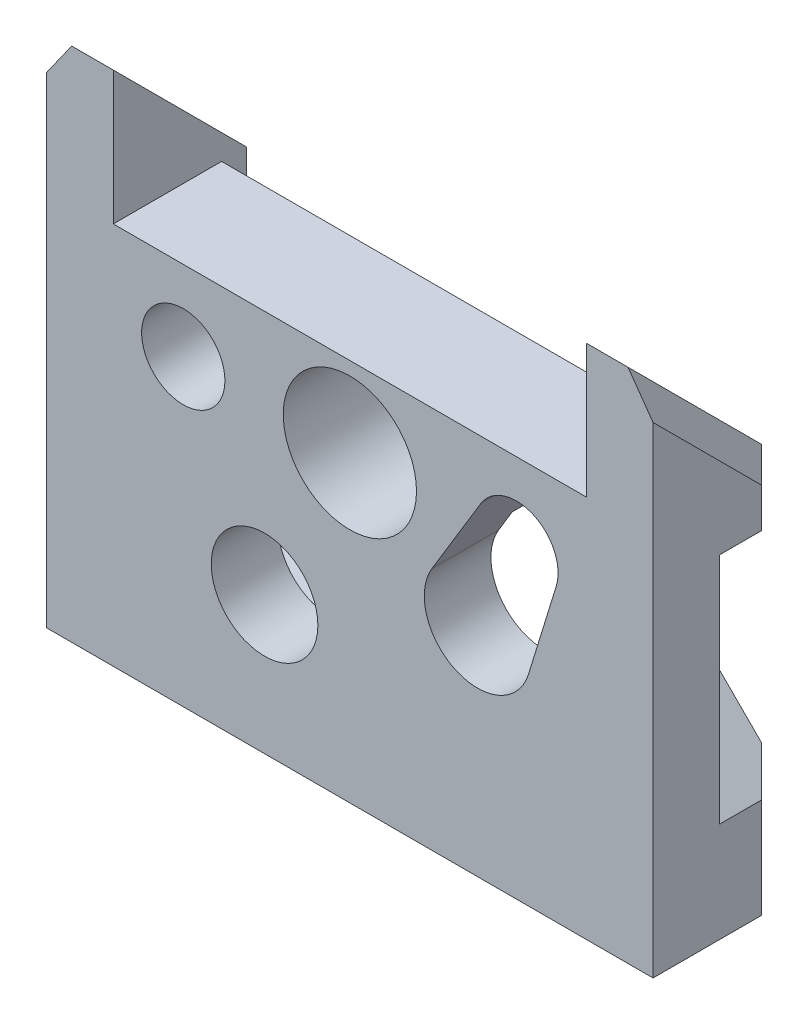
from build123d import *

# Parameters (mm, degrees)
OUTER_FRAME_EXTRUDE_DEPTH      = 4
OUTER_FRAME_EXTRUDE_DEPTH_BACK = 2
OUTSIDE_FRAME_W                = 18.2
OUTSIDE_FRAME_H                = 18.2
OUTSIDE_FRAME_W_2              = 14.2
OUTSIDE_FRAME_H_2              = 14.2
HOTSWAP_BASE_W                 = 18.2
HOTSWAP_BASE_H                 = 11.5
HOTSWAP_BASE_BLOCK_DEPTH       = 4
CUT_EXTRUDE4_DEPTH             = 16.15321748
CUT_EXTRUDE4_DEPTH_BACK        = 16.15321748
SKETCH1_W                      = 2
SKETCH1_H                      = 6.7
CUT_EXTRUDE1_DEPTH             = 4
SWITCH_PIN_HOLES_R             = 2
SWITCH_PIN_HOLES_R_2           = 1.25
SWITCH_HOLES_DEPTH             = 3.6
CUT_EXTRUDE3_REACH             = 17.153
HOTSWAP_HOLES_R                = 1.6
CHAMFER1_SIZE                  = 2
CHAMFER2_SIZE                  = 4
FILLET1_R                      = 0.35
CHAMFER3_SIZE                  = 0.75


# Some blends are built 0.0001 mm under size
with BuildPart() as part:
    # Outside Frame → Outer Frame Extrude (new, two sides: drawn at the far end of the back side and taken through both)
    with BuildSketch(Plane.XY.offset(-4).offset(-OUTER_FRAME_EXTRUDE_DEPTH_BACK)):
        Rectangle(OUTSIDE_FRAME_W, OUTSIDE_FRAME_H)
        Rectangle(OUTSIDE_FRAME_W_2, OUTSIDE_FRAME_H_2, mode=Mode.SUBTRACT)
    extrude(amount=OUTER_FRAME_EXTRUDE_DEPTH + OUTER_FRAME_EXTRUDE_DEPTH_BACK)

    # Hotswap Base → Hotswap Base Block (add)
    with BuildSketch(Plane.XY.offset(-4)):
        with Locations((0, -3.35)):
            Rectangle(HOTSWAP_BASE_W, HOTSWAP_BASE_H)
    extrude(amount=-HOTSWAP_BASE_BLOCK_DEPTH)

    # Sketch1 → Cut-Extrude4 (cut, two sides: drawn at the far end of the back side and taken through both)
    with BuildSketch(Plane(origin=(0, 0, 0), x_dir=(0, 0, -1), z_dir=(1, 0, 0)).offset(-CUT_EXTRUDE4_DEPTH_BACK)):
        with Locations((5, 5.75)):
            Rectangle(SKETCH1_W, SKETCH1_H)
    extrude(amount=CUT_EXTRUDE4_DEPTH + CUT_EXTRUDE4_DEPTH_BACK, mode=Mode.SUBTRACT)

    # Hotswap Well → Cut-Extrude1 (cut)
    with BuildSketch(Plane(origin=(0, 0, -6), x_dir=(-1, 0, 0), z_dir=(0, 0, -1))):
        with BuildLine():
            Line((-10, -1.1), (-2.355843798, -1.1))
            ThreePointArc((-2.355843798, -1.1), (-1.396424004, -2.19317122), (0, -2.6))
            Line((0, -2.6), (5, -2.6))
            Line((5, -2.6), (5, -3.35))
            Line((5, -3.35), (10, -3.35))
            Line((10, -3.35), (10, -6.9))
            Line((10, -6.9), (-6, -6.9))
            Line((-6, -6.9), (-6, -4.1))
            Line((-6, -4.1), (-10, -4.1))
            Line((-10, -4.1), (-10, -1.1))
        make_face()
    extrude(amount=CUT_EXTRUDE1_DEPTH, mode=Mode.SUBTRACT)

    # Switch Pin Holes → Switch Holes (cut)
    with BuildSketch(Plane.XY.offset(-4)):
        Circle(SWITCH_PIN_HOLES_R)
        with Locations((-5, 0)):
            Circle(SWITCH_PIN_HOLES_R_2)
        with Locations((5, 0)):
            Circle(SWITCH_PIN_HOLES_R_2)
    extrude(amount=-SWITCH_HOLES_DEPTH, mode=Mode.SUBTRACT)

    # Cut-Extrude3: up to this face of the body (flat: up to its plane)
    cut_extrude3_end = Plane(part.part.faces().sort_by_distance((5, 0.029137252, -7.6))[0])
    # Hotswap Holes → Cut-Extrude3 (cut, up to the picked face)
    with BuildSketch(Plane.XY, mode=Mode.PRIVATE) as cut_extrude3_sk1:
        with Locations((-2.560136595, -4.965291588)):
            Circle(HOTSWAP_HOLES_R)
    cut_extrude3_tool1 = split(extrude(cut_extrude3_sk1.sketch, amount=-CUT_EXTRUDE3_REACH, mode=Mode.PRIVATE), bisect_by=cut_extrude3_end, keep=Keep.BOTH, mode=Mode.PRIVATE)
    # Hotswap Holes → Cut-Extrude3 (cut, up to the picked face)
    with BuildSketch(Plane.XY, mode=Mode.PRIVATE) as cut_extrude3_sk2:
        with BuildLine():
            Line((3.930924016, 0.647747281), (2.46548889, -1.77088348))
            ThreePointArc((2.46548889, -1.77088348), (3.179147124, -4.059894044), (5.3631684, -3.070485887))
            Line((5.3631684, -3.070485887), (6.194736133, -0.367567099))
            ThreePointArc((6.194736133, -0.367567099), (5.511530489, 1.140542222), (3.930924016, 0.647747281))
        make_face()
    cut_extrude3_tool2 = split(extrude(cut_extrude3_sk2.sketch, amount=-CUT_EXTRUDE3_REACH, mode=Mode.PRIVATE), bisect_by=cut_extrude3_end, keep=Keep.BOTH, mode=Mode.PRIVATE)
    add(cut_extrude3_tool1.solids().sort_by(Axis((-2.560137, -4.965292, 0), (0, 0, -1)))[0], mode=Mode.SUBTRACT)
    add(cut_extrude3_tool2.solids().sort_by(Axis((4.301523, -1.557372, 0), (0, 0, -1)))[0], mode=Mode.SUBTRACT)

    # Chamfer1
    chamfer1_edges = [part.edges().sort_by_distance(p)[0] for p in [
        (9.1, -4.1, -7),
        (-9.1, -6.9, -7),
        (-9.1, -3.35, -7),
        (9.1, -1.1, -7),
    ]]
    chamfer(chamfer1_edges, length=CHAMFER1_SIZE)

    # Chamfer2
    chamfer2_edges = [part.edges().sort_by_distance(p)[0] for p in [
        (-8.1, 2.4, -4),
        (8.1, 2.4, -4),
    ]]
    chamfer(chamfer2_edges, length=CHAMFER2_SIZE - 0.0001)  # a hair under: the kernel refuses the full size

    # Fillet1
    fillet1_edges = [part.edges().sort_by_distance(p)[0] for p in [
        (6, -4.1, -7),
        (-5, -3.35, -7),
        (-5, -2.6, -7),
        (6, -6.9, -7),
        (2.355843798, -1.1, -7),
    ]]
    fillet(fillet1_edges, radius=FILLET1_R)

    # Chamfer3
    # the kernel refuses this chamfer: 0.75 mm, written as the material it takes off along each edge
    with BuildSketch(Plane(origin=(9.1, 4.328762241, -8), x_dir=(-0.9996219169112965, 0, -0.02749587661058676), z_dir=(0, -1, 0))) as chamfer3_piece_1:
        Polygon((CHAMFER3_SIZE * 0.999621916911, -CHAMFER3_SIZE * 0.0274958766106), (-CHAMFER3_SIZE * 0.0274958766106, -CHAMFER3_SIZE * 0.999621916911), (0, 0), align=None)
    extrude(amount=5.357524482, mode=Mode.SUBTRACT)
    with BuildSketch(Plane(origin=(-9.1, -3.278762241, -8), x_dir=(0.9996219169112965, 0, -0.02749587661058676), z_dir=(0, 1, 0))) as chamfer3_piece_2:
        Polygon((CHAMFER3_SIZE * 0.999621916911, -CHAMFER3_SIZE * 0.0274958766106), (-CHAMFER3_SIZE * 0.0274958766106, -CHAMFER3_SIZE * 0.999621916911), (0, 0), align=None)
    extrude(amount=7.607524482, mode=Mode.SUBTRACT)
    with BuildSketch(Plane(origin=(-9.1, -11.028762241, -8), x_dir=(-0.027495876610586768, 0, 0.9996219169112968), z_dir=(0, 1, 0))) as chamfer3_piece_3:
        Polygon((CHAMFER3_SIZE * 0.999621916911, CHAMFER3_SIZE * 0.0274958766106), (-CHAMFER3_SIZE * 0.0274958766106, CHAMFER3_SIZE * 0.999621916911), (0, 0), align=None)
    extrude(amount=4.057524482, mode=Mode.SUBTRACT)
    with BuildSketch(Plane(origin=(9.1, -4.171237759, -8), x_dir=(0.027495876610586768, 0, 0.9996219169112968), z_dir=(0, -1, 0))) as chamfer3_piece_4:
        Polygon((CHAMFER3_SIZE * 0.999621916911, CHAMFER3_SIZE * 0.0274958766106), (-CHAMFER3_SIZE * 0.0274958766106, CHAMFER3_SIZE * 0.999621916911), (0, 0), align=None)
    extrude(amount=6.857524482, mode=Mode.SUBTRACT)
    with BuildSketch(Plane(origin=(11.028762241, -9.1, -8), x_dir=(0, -0.027495876610586768, 0.9996219169112968), z_dir=(-1, 0, 0))) as chamfer3_piece_5:
        Polygon((CHAMFER3_SIZE * 0.999621916911, CHAMFER3_SIZE * 0.0274958766106), (-CHAMFER3_SIZE * 0.0274958766106, CHAMFER3_SIZE * 0.999621916911), (0, 0), align=None)
    extrude(amount=22.057524482, mode=Mode.SUBTRACT)
    with BuildSketch(Plane(origin=(-11.028762241, 2.4, -8), x_dir=(0, -0.9996219169112968, -0.027495876610586775), z_dir=(1, 0, 0))) as chamfer3_piece_6_section:
        Polygon((CHAMFER3_SIZE * 0.999621916911, -CHAMFER3_SIZE * 0.0274958766106), (-CHAMFER3_SIZE * 0.0274958766106, -CHAMFER3_SIZE * 0.999621916911), (0, 0), align=None)
    chamfer3_piece_6 = extrude(amount=22.057524482, mode=Mode.PRIVATE)
    chamfer3_piece_6 = split(chamfer3_piece_6, bisect_by=Plane(origin=(7.1, 2.149999996, -7.749999996), z_dir=(-1, 0, 0)), keep=Keep.TOP, mode=Mode.PRIVATE)
    chamfer3_piece_6 = split(chamfer3_piece_6, bisect_by=Plane(origin=(-7.1, 2.149999996, -7.749999996), z_dir=(1, 0, 0)), keep=Keep.TOP, mode=Mode.PRIVATE)
    add(chamfer3_piece_6, mode=Mode.SUBTRACT)
    with BuildSketch(Plane(origin=(9.1, 7.76374086, -2.63615914), x_dir=(0.02749587661058679, -0.7068394360706739, 0.706839436070673), z_dir=(0, -0.7071067811865471, -0.7071067811865479))) as chamfer3_piece_7_section:
        Polygon((CHAMFER3_SIZE * 0.999621916911, CHAMFER3_SIZE * 0.0274958766106), (-CHAMFER3_SIZE * 0.0274958766106, CHAMFER3_SIZE * 0.999621916911), (0, 0), align=None)
    chamfer3_piece_7 = extrude(amount=9.51423731, mode=Mode.PRIVATE)
    chamfer3_piece_7 = split(chamfer3_piece_7, bisect_by=Plane(origin=(8.843939938, 4.231743527, -4), z_dir=(0, 0, -1)), keep=Keep.TOP, mode=Mode.PRIVATE)
    add(chamfer3_piece_7, mode=Mode.SUBTRACT)
    with BuildSketch(Plane(origin=(-9.1, 7.76374086, -2.63615914), x_dir=(-0.027495876610586768, -0.7068394360706739, 0.706839436070673), z_dir=(0, -0.7071067811865471, -0.7071067811865479))) as chamfer3_piece_8_section:
        Polygon((CHAMFER3_SIZE * 0.999621916911, -CHAMFER3_SIZE * 0.0274958766106), (-CHAMFER3_SIZE * 0.0274958766106, -CHAMFER3_SIZE * 0.999621916911), (0, 0), align=None)
    chamfer3_piece_8 = extrude(amount=9.51423731, mode=Mode.PRIVATE)
    chamfer3_piece_8 = split(chamfer3_piece_8, bisect_by=Plane(origin=(-8.843939938, 4.231743527, -4), z_dir=(0, 0, -1)), keep=Keep.TOP, mode=Mode.PRIVATE)
    add(chamfer3_piece_8, mode=Mode.SUBTRACT)

    # Split1
    split(bisect_by=Plane.XY.offset(-4), keep=Keep.BOTTOM)


solid = part.part
